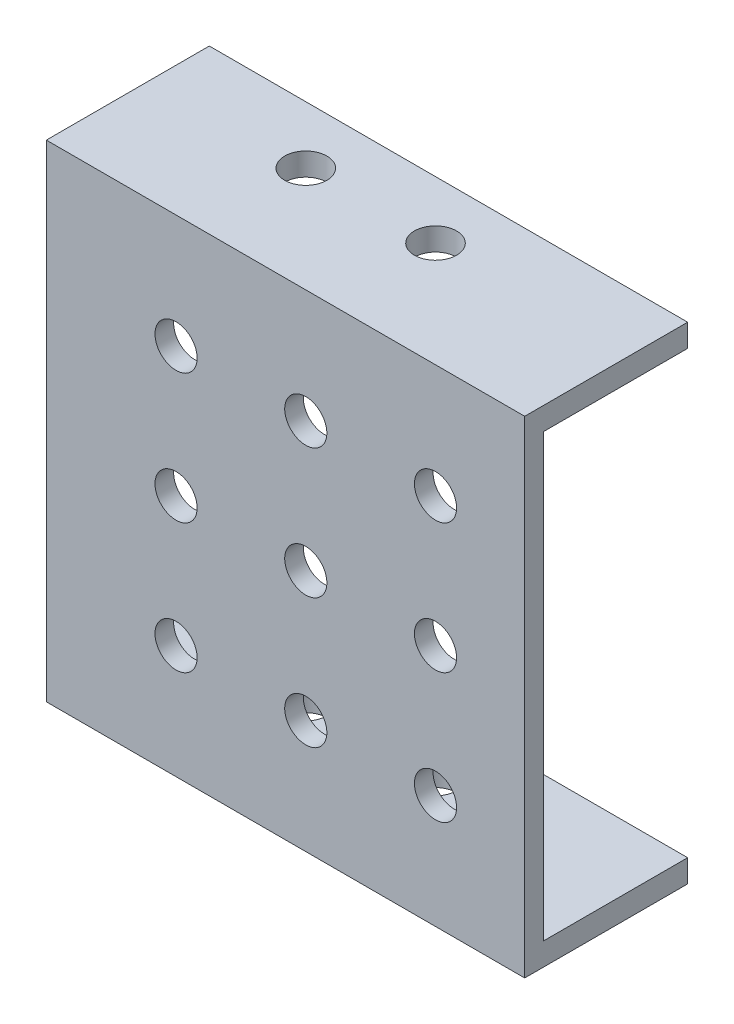
from build123d import *

# Parameters (mm, degrees)
SKETCH_1_W          = 295
SKETCH_1_H          = 300
SKETCH_1_R          = 13
EXTRUDE_471_DEPTH   = 11.5
SKETCH_2_W          = 295
SKETCH_2_H          = 14
EXTRUDE_1_DEPTH     = 89
SKETCH_3_R          = 13
CUT_EXTRUDE_1_DEPTH = 346.943998358


with BuildPart() as part:
    # 草图1 → Extrude 471 (new body)
    with BuildSketch(Plane.XY):
        with Locations((0, 150)):
            Rectangle(SKETCH_1_W, SKETCH_1_H)
        with Locations((92.5, 230)):
            Circle(SKETCH_1_R, mode=Mode.SUBTRACT)
        with Locations((92.5, 150)):
            Circle(SKETCH_1_R, mode=Mode.SUBTRACT)
        with Locations((92.5, 70)):
            Circle(SKETCH_1_R, mode=Mode.SUBTRACT)
        with Locations((12.5, 230)):
            Circle(SKETCH_1_R, mode=Mode.SUBTRACT)
        with Locations((-67.5, 230)):
            Circle(SKETCH_1_R, mode=Mode.SUBTRACT)
        with Locations((-67.5, 150)):
            Circle(SKETCH_1_R, mode=Mode.SUBTRACT)
        with Locations((-67.5, 70)):
            Circle(SKETCH_1_R, mode=Mode.SUBTRACT)
        with Locations((12.5, 70)):
            Circle(SKETCH_1_R, mode=Mode.SUBTRACT)
        with Locations((12.5, 150)):
            Circle(SKETCH_1_R, mode=Mode.SUBTRACT)
    extrude(amount=EXTRUDE_471_DEPTH)

    # 草图2 → 凸台-拉伸1 (add)
    with BuildSketch(Plane(origin=(0, 0, 0), x_dir=(-1, 0, 0), z_dir=(0, 0, -1))):
        with Locations((0, 293)):
            Rectangle(SKETCH_2_W, SKETCH_2_H)
        with Locations((0, 7)):
            Rectangle(SKETCH_2_W, SKETCH_2_H)
    extrude(amount=EXTRUDE_1_DEPTH)

    # 草图3 → 切除-拉伸1 (cut, through all)
    with BuildSketch(Plane(origin=(0, 300, 0), x_dir=(-1, 0, 0), z_dir=(0, 1, 0))):
        with Locations((-27.5, -53.5)):
            Circle(SKETCH_3_R)
        with Locations((52.5, -53.5)):
            Circle(SKETCH_3_R)
    extrude(amount=-CUT_EXTRUDE_1_DEPTH, mode=Mode.SUBTRACT)


solid = part.part
